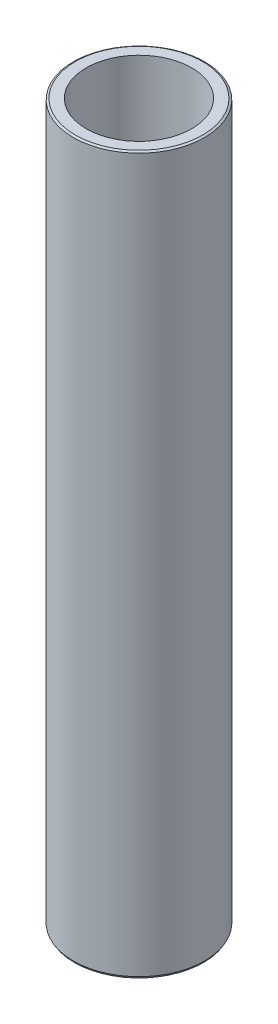
from build123d import *
from OCP.BRepFilletAPI import BRepFilletAPI_MakeChamfer

# Parameters (mm, degrees)
SKETCH1_R           = 55
BOSS_EXTRUDE1_DEPTH = 600
SKETCH2_R           = 44.215505473
CUT_EXTRUDE1_DEPTH  = 606.020660804
CHAMFER1_SIZE       = 0.952354217
CHAMFER1_SIZE2      = 1.649525891


with BuildPart() as part:
    # Sketch1 → Boss-Extrude1 (new body)
    with BuildSketch(Plane(origin=(0, 0, 0), x_dir=(1, 0, 0), z_dir=(0, 1, 0))):
        Circle(SKETCH1_R)
    extrude(amount=BOSS_EXTRUDE1_DEPTH)

    # Sketch2 → Cut-Extrude1 (cut, through all)
    with BuildSketch(Plane(origin=(0, 0, 0), x_dir=(1, 0, 0), z_dir=(0, 1, 0))):
        Circle(SKETCH2_R)
    extrude(amount=CUT_EXTRUDE1_DEPTH, mode=Mode.SUBTRACT)

    # Chamfer1: one chamfer whose edges measure the first distance from different faces: ONE call of the kernel's chamfer builder (chamfer() names one face for all edges)
    chamfer1_edges_1 = [part.edges().sort_by_distance(p)[0] for p in [
        (-55, 600, 0),
    ]]
    chamfer1_side_1 = [part.faces().sort_by_distance(p)[0] for p in [
        (-55, 300, 0),
    ]]
    chamfer1_edges_2 = [part.edges().sort_by_distance(p)[0] for p in [
        (-55, 0, 0),
    ]]
    chamfer1_side_2 = [part.faces().sort_by_distance(p)[0] for p in [
        (-53.444365081, 0, 0),
    ]]
    chamfer1 = BRepFilletAPI_MakeChamfer(part.part.solid().wrapped)
    for e in chamfer1_edges_1:
        chamfer1.Add(CHAMFER1_SIZE, CHAMFER1_SIZE2, e.wrapped, chamfer1_side_1[0].wrapped)  # the first distance lies on this face
    for e in chamfer1_edges_2:
        chamfer1.Add(CHAMFER1_SIZE, CHAMFER1_SIZE2, e.wrapped, chamfer1_side_2[0].wrapped)  # the first distance lies on this face
    add(Compound.cast(chamfer1.Shape()), mode=Mode.REPLACE)


solid = part.part
